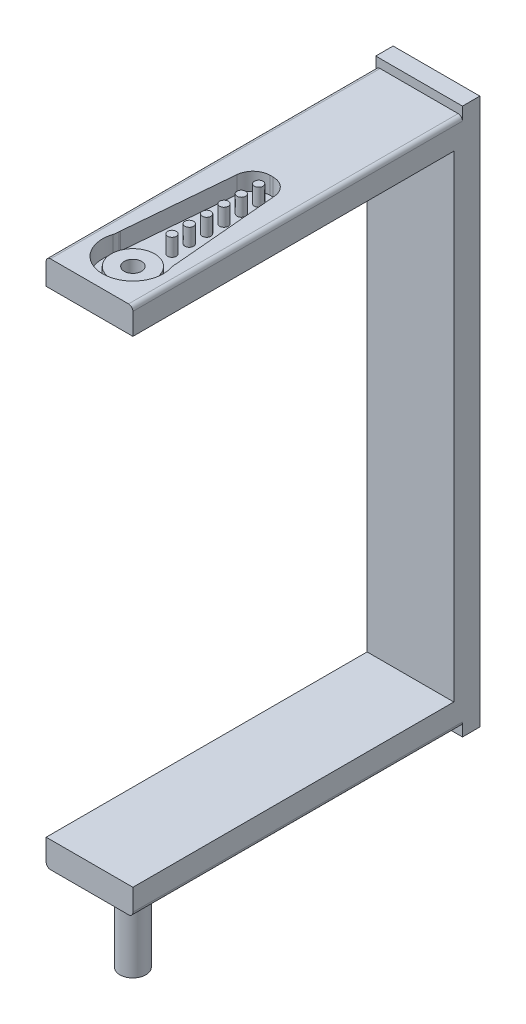
from build123d import *

# Parameters (mm, degrees)
SKETCH1_W             = 10
SKETCH1_H             = 40
BOSS_EXTRUDE1_DEPTH   = 3
CAVITY4_START         = 1
CAVITY4_OUTLINE_R     = 2.5
CAVITY4_OUTLINE_R_2   = 0.5
CAVITY4_DEPTH         = 2
CAVITY4_START_2       = 2
CAVITY4_2_OUTLINE_R   = 2.5
CAVITY4_2_OUTLINE_R_2 = 1
CAVITY4_2_DEPTH       = 1
CUT_EXTRUDE4_START    = -23
SKETCH5_R             = 1
CUT_EXTRUDE4_DEPTH    = 23
SKETCH7_W             = 10
SKETCH7_H             = 3
BOSS_EXTRUDE3_DEPTH   = 55
SKETCH8_R             = 1.5
BOSS_EXTRUDE4_DEPTH   = 10
SKETCH9_W             = 10
SKETCH9_H             = 2
BOSS_EXTRUDE5_DEPTH   = 1
FILLET2_R             = 0.5
FILLET3_R             = 0.5


# Read off the part's stored shape, not the designer's step: Cavity4
with BuildPart() as part:
    # Sketch1 → Boss-Extrude1 (new body)
    with BuildSketch(Plane(origin=(0, 0, 0), x_dir=(1, 0, 0), z_dir=(0, 1, 0))):
        with Locations((1.621359223, -14.684466019)):
            Rectangle(SKETCH1_W, SKETCH1_H)
    boss_extrude1 = extrude(amount=BOSS_EXTRUDE1_DEPTH)

    # Cavity4 outline → Cavity4 (cut)
    with BuildSketch(Plane(origin=(0, 0, 0), x_dir=(1, 0, 0), z_dir=(0, 1, 0)).offset(CAVITY4_START)):
        with BuildLine():
            Line((-0.538748891, -15.509698524), (-1.620990225, -27.847249725))
            ThreePointArc((-1.620990225, -27.847249725), (-1.626727223, -27.934549786), (-1.628640777, -28.022017221))
            Line((-1.628640777, -28.022017221), (-1.628640777, -28.045106388))
            ThreePointArc((-1.628640777, -28.045106388), (-1.65149867, -28.346617733), (-1.719549868, -28.641237163))
            ThreePointArc((-1.719549868, -28.641237163), (1.621359223, -33.184466019), (4.962268314, -28.641237163))
            ThreePointArc((4.962268314, -28.641237163), (4.894217117, -28.346617733), (4.871359223, -28.045106388))
            Line((4.871359223, -28.045106388), (4.871359223, -28.022017221))
            ThreePointArc((4.871359223, -28.022017221), (4.86944567, -27.934549786), (4.863708671, -27.847249725))
            Line((4.863708671, -27.847249725), (3.781467338, -15.509698524))
            ThreePointArc((3.781467338, -15.509698524), (3.14012955, -14.209756728), (1.78911789, -13.684466019))
            Line((1.78911789, -13.684466019), (1.453600557, -13.684466019))
            ThreePointArc((1.453600557, -13.684466019), (0.102588897, -14.209756728), (-0.538748891, -15.509698524))
        make_face()
        with Locations((1.621359223, -29.684466019)):
            Circle(CAVITY4_OUTLINE_R, mode=Mode.SUBTRACT)
        with Locations((1.621359223, -25.184466019)):
            Circle(CAVITY4_OUTLINE_R_2, mode=Mode.SUBTRACT)
        with Locations((1.621359223, -23.184466019)):
            Circle(CAVITY4_OUTLINE_R_2, mode=Mode.SUBTRACT)
        with Locations((1.621359223, -21.184466019)):
            Circle(CAVITY4_OUTLINE_R_2, mode=Mode.SUBTRACT)
        with Locations((1.621359223, -19.184466019)):
            Circle(CAVITY4_OUTLINE_R_2, mode=Mode.SUBTRACT)
        with Locations((1.621359223, -17.184466019)):
            Circle(CAVITY4_OUTLINE_R_2, mode=Mode.SUBTRACT)
        with Locations((1.621359223, -15.184466019)):
            Circle(CAVITY4_OUTLINE_R_2, mode=Mode.SUBTRACT)
    extrude(amount=CAVITY4_DEPTH, mode=Mode.SUBTRACT)

    # Cavity4 2 outline → Cavity4 2 (cut)
    with BuildSketch(Plane(origin=(0, 0, 0), x_dir=(1, 0, 0), z_dir=(0, 1, 0)).offset(CAVITY4_START_2)):
        with Locations((1.621359223, -29.684466019)):
            Circle(CAVITY4_2_OUTLINE_R)
        with Locations((1.621359223, -29.684466019)):
            Circle(CAVITY4_2_OUTLINE_R_2, mode=Mode.SUBTRACT)
    extrude(amount=CAVITY4_2_DEPTH, mode=Mode.SUBTRACT)

    # Sketch5 → Cut-Extrude4 (cut)
    with BuildSketch(Plane(origin=(0, 3, 0), x_dir=(1, 0, 0), z_dir=(0, 1, 0)).offset(CUT_EXTRUDE4_START)):
        with Locations(Location((1.621359223, -29.684466019, 0), (0, 0, 270))):
            Circle(SKETCH5_R)
    extrude(amount=CUT_EXTRUDE4_DEPTH, mode=Mode.SUBTRACT)

    # Sketch7 → Boss-Extrude3 (add)
    with BuildSketch(Plane.XZ):
        with Locations((1.621359223, -3.815533981)):
            Rectangle(SKETCH7_W, SKETCH7_H)
    extrude(amount=BOSS_EXTRUDE3_DEPTH)

    # Mirror1: Boss-Extrude1 across plane
    add(boss_extrude1.mirror(Plane(origin=(0, -27.5, 0), x_dir=(0, 0, 1), z_dir=(0, -1, 0))))

    # Sketch8 → Boss-Extrude4 (add)
    with BuildSketch(Plane.XZ.offset(58)):
        with Locations(Location((1.621359223, 29.684466019, 0), (0, 0, 270))):
            Circle(SKETCH8_R)
    extrude(amount=BOSS_EXTRUDE4_DEPTH)

    # Sketch9 → Boss-Extrude5 (add)
    with BuildSketch(Plane.XZ.offset(58)):
        with Locations((1.621359223, -4.315533981)):
            Rectangle(SKETCH9_W, SKETCH9_H)
    boss_extrude5 = extrude(amount=BOSS_EXTRUDE5_DEPTH)

    # Mirror2: Boss-Extrude5 across plane
    add(boss_extrude5.mirror(Plane(origin=(0, -27.5, 0), x_dir=(0, 0, 1), z_dir=(0, -1, 0))))

    # Fillet2
    fillet2_edges = [part.edges().sort_by_distance(p)[0] for p in [
        (6.621359223, 3, 15.684466019),
        (6.621359223, -58, 15.684466019),
    ]]
    fillet(fillet2_edges, radius=FILLET2_R)

    # Fillet3
    fillet3_edges = [part.edges().sort_by_distance(p)[0] for p in [
        (-3.378640777, -58, 15.684466019),
        (-3.378640777, 3, 15.684466019),
    ]]
    fillet(fillet3_edges, radius=FILLET3_R)


solid = part.part
